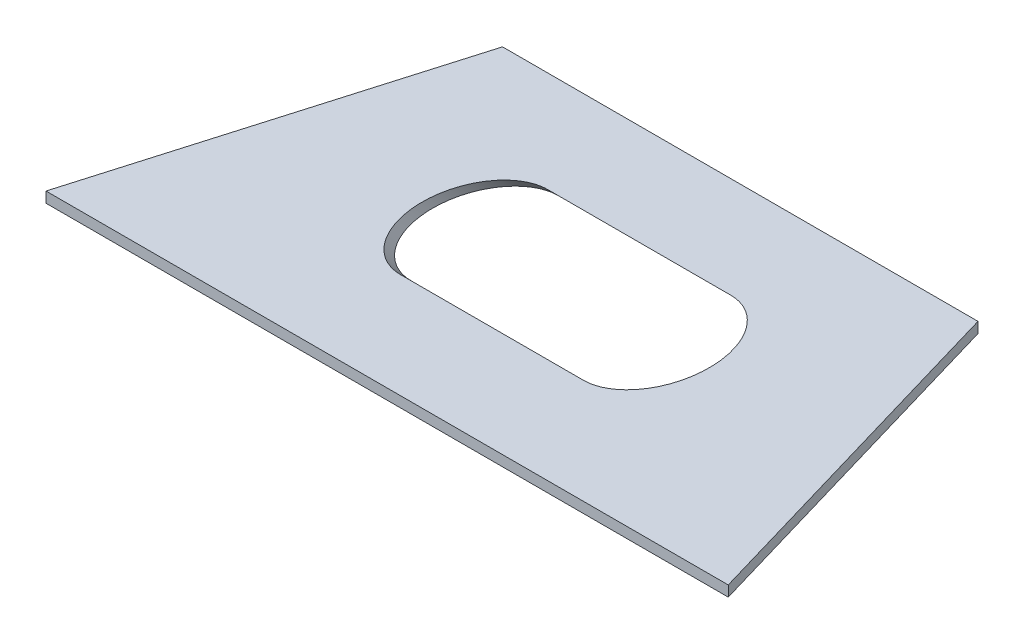
from build123d import *

# Parameters (mm, degrees)
BOSS_EXTRUDE1_DEPTH = 3
CUT_EXTRUDE4_DEPTH  = 219.244679202


with BuildPart() as part:
    # Sketch1 → Boss-Extrude1 (new body)
    with BuildSketch(Plane(origin=(0, 0, 0), x_dir=(1, 0, 0), z_dir=(0, 1, 0))):
        Polygon((0, 0), (193.2, 0), (163.920058283, 100), (29.279941717, 100), align=None)
    extrude(amount=BOSS_EXTRUDE1_DEPTH)

    # Sketch8 → Cut-Extrude4 (cut, through all)
    with BuildSketch(Plane(origin=(0, 1.5, 1.5), x_dir=(-1, 0, 0), z_dir=(0, -0.7071067811865464, -0.7071067811865488))):
        with BuildLine():
            Line((-122.5, 52.61333471), (-70.7, 52.61333471))
            ThreePointArc((-70.7, 52.61333471), (-55.95, 37.86333471), (-70.7, 23.11333471))
            Line((-70.7, 23.11333471), (-122.5, 23.11333471))
            ThreePointArc((-122.5, 23.11333471), (-137.25, 37.86333471), (-122.5, 52.61333471))
        make_face()
    extrude(amount=CUT_EXTRUDE4_DEPTH, mode=Mode.SUBTRACT)


solid = part.part
